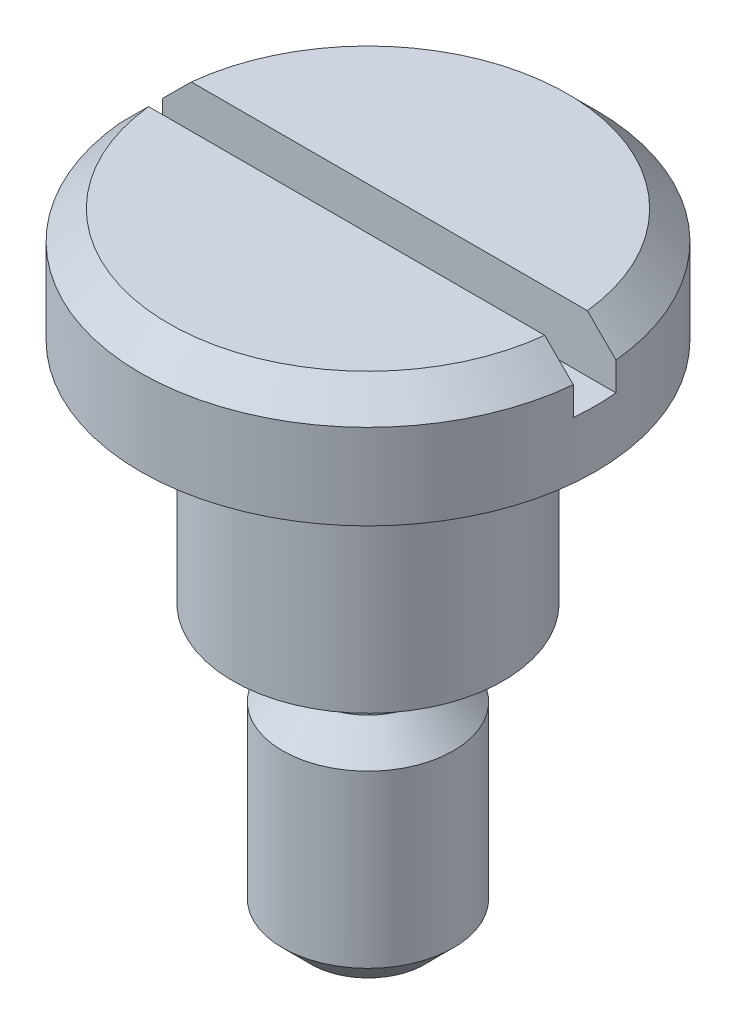
from build123d import *

# Parameters (mm, degrees)
CHAMFER_2_SIZE      = 1
CUT_EXTRUDE_1_DEPTH = 2


with BuildPart() as part:
    # 草图1 → 旋转1 (revolve)
    with BuildSketch(Plane.XY, mode=Mode.PRIVATE) as revolve_1_sk:
        Polygon((0, 0), (3, 0), (3, 8), (2, 8), (2, 10), (4.75, 10), (4.75, 18), (8, 18), (8, 22), (0, 22), align=None)
    revolve(revolve_1_sk.sketch.rotate(Axis((0, 22, 0), (0, -1, 0)), 180), axis=Axis((0, 22, 0), (0, -1, 0)))

    # 倒角2
    chamfer_2_edges = [part.edges().sort_by_distance(p)[0] for p in [
        (3, 8, 0),
        (3, 0, 0),
        (8, 22, 0),
    ]]
    chamfer(chamfer_2_edges, length=CHAMFER_2_SIZE - 0.0001)  # a hair under: the kernel refuses the full size

    # 草图2 → 切除-拉伸1 (cut)
    with BuildSketch(Plane(origin=(0, 22, 0), x_dir=(1, 0, 0), z_dir=(0, 1, 0))):
        with BuildLine():
            Line((-7.964766161, -0.75), (7.964766161, -0.75))
            ThreePointArc((7.964766161, -0.75), (8, 0), (7.964766161, 0.75))
            Line((7.964766161, 0.75), (-7.964766161, 0.75))
            ThreePointArc((-7.964766161, 0.75), (-8, 0), (-7.964766161, -0.75))
        make_face()
    extrude(amount=-CUT_EXTRUDE_1_DEPTH, mode=Mode.SUBTRACT)


solid = part.part
